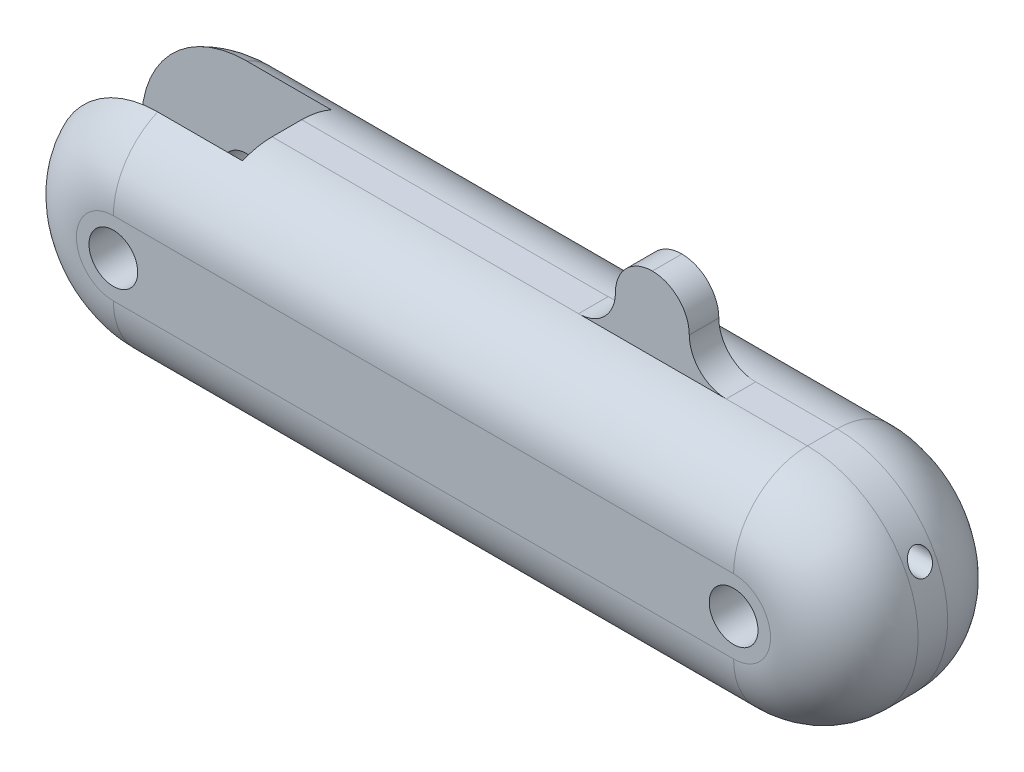
from build123d import *

# Parameters (mm, degrees)
BOSS_EXTRUDE1_DEPTH = 12
FILLET1_R           = 5
SKETCH5_W           = 13.25
SKETCH5_H           = 6
CUT_EXTRUDE3_DEPTH  = 40.764934301
SKETCH6_W           = 5
SKETCH6_H           = 2
BOSS_EXTRUDE2_DEPTH = 5
FILLET2_R           = 2.5
FILLET3_R           = 2.5
SKETCH3_R           = 1.65
CUT_EXTRUDE4_DEPTH  = 35.369317791
SKETCH8_R           = 0.75
CUT_EXTRUDE7_DEPTH  = 60.754396399
SKETCH9_R           = 0.75
CUT_EXTRUDE9_DEPTH  = 30.513316765


with BuildPart() as part:
    # Sketch2 → Boss-Extrude1 (new body)
    with BuildSketch(Plane.XY):
        with BuildLine():
            Line((-21, 0), (21, 0))
            ThreePointArc((21, 0), (28.5, -7.5), (21, -15))
            Line((21, -15), (-21, -15))
            ThreePointArc((-21, -15), (-28.5, -7.5), (-21, 0))
        make_face()
    extrude(amount=BOSS_EXTRUDE1_DEPTH)

    # Fillet1
    fillet1_edges = [part.edges().sort_by_distance(p)[0] for p in [
        (-28.5, -7.5, 12),
        (0, -15, 12),
        (28.5, -7.5, 12),
        (0, -15, 0),
        (-28.5, -7.5, 0),
        (0, 0, 0),
        (28.5, -7.5, 0),
        (0, 0, 12),
    ]]
    fillet(fillet1_edges, radius=FILLET1_R)

    # Sketch5 → Cut-Extrude3 (cut, through all)
    with BuildSketch(Plane(origin=(0, -25, 0), x_dir=(-1, 0, 0), z_dir=(0, -1, 0))):
        with Locations((21.875, -6)):
            Rectangle(SKETCH5_W, SKETCH5_H)
    extrude(amount=-CUT_EXTRUDE3_DEPTH, mode=Mode.SUBTRACT)

    # Sketch6 → Boss-Extrude2 (add)
    with BuildSketch(Plane(origin=(0, 0, 0), x_dir=(1, 0, 0), z_dir=(0, 1, 0))):
        with Locations((10.5, -6)):
            Rectangle(SKETCH6_W, SKETCH6_H)
    extrude(amount=BOSS_EXTRUDE2_DEPTH)

    # Fillet2
    fillet2_edges = [part.edges().sort_by_distance(p)[0] for p in [
        (13, 5, 6),
        (8, 5, 6),
    ]]
    fillet(fillet2_edges, radius=FILLET2_R - 0.0001)  # a hair under: the kernel refuses the full size

    # Fillet3
    fillet3_edges = [part.edges().sort_by_distance(p)[0] for p in [
        (8, 0, 6),
        (13, 0, 6),
    ]]
    fillet(fillet3_edges, radius=FILLET3_R)

    # Sketch3 → Cut-Extrude4 (cut, through all)
    with BuildSketch(Plane.XY.offset(12)):
        with Locations((-21, -7.5)):
            Circle(SKETCH3_R)
        with Locations((21, -7.5)):
            Circle(SKETCH3_R)
    extrude(amount=-CUT_EXTRUDE4_DEPTH, mode=Mode.SUBTRACT)

    # Sketch8 → Cut-Extrude7 (cut, through all)
    with BuildSketch(Plane(origin=(28.5, 0, 0), x_dir=(0, 0, -1), z_dir=(1, 0, 0))):
        with Locations((-6, -4)):
            Circle(SKETCH8_R)
    extrude(amount=-CUT_EXTRUDE7_DEPTH, mode=Mode.SUBTRACT)

    # Sketch9 → Cut-Extrude9 (cut, along a direction that is not the sketch's normal)
    with BuildSketch(Plane.ZY.offset(15.25)):
        with Locations((6, -11)):
            Circle(SKETCH9_R)
    extrude(amount=-CUT_EXTRUDE9_DEPTH, dir=(-0.9913704312445624, 0.1310903049579585, 0), mode=Mode.SUBTRACT)


solid = part.part
